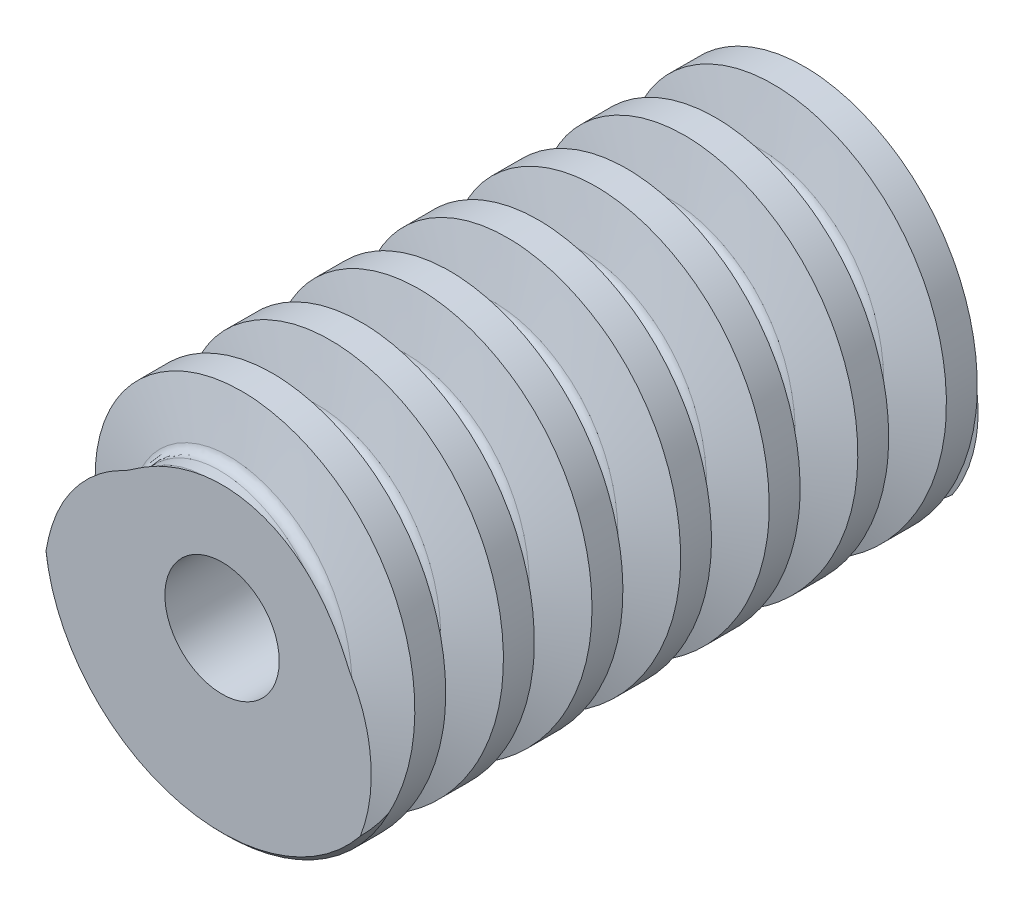
from build123d import *

# Parameters (mm, degrees)
TOOTH_CUT_SWEEP_RH_PD_1_1667IN_PITCH = 3.0988
SKETCH3_R                            = 2
CUT_EXTRUDE1_DEPTH                   = 24.383179999


with BuildPart() as part:
    # Worm-BaseSketch → 24.0 Diametral Pitch, Fine Pitch Involute 14.5 deg (revolve)
    with BuildSketch(Plane(origin=(0, 0, 0), x_dir=(0, 0, -1), z_dir=(1, 0, 0)), mode=Mode.PRIVATE) as f_24_0_diametral_pitch_fine_pitch_involut_sk:
        Polygon((-12.85875, 0), (8.73125, 0), (8.73125, 6.201833333), (8.583083333, 6.35), (-12.710583333, 6.35), (-12.85875, 6.201833333), align=None)
    revolve(f_24_0_diametral_pitch_fine_pitch_involut_sk.sketch.rotate(Axis((0, 0, 17.4625), (0, 0, -1)), 90), axis=Axis((0, 0, 17.4625), (0, 0, -1)))

    # Tooth-Cut-Sweep RH, PD: 1.1667in: arcs per turn and ends read off the stored shape
    # Tooth-Cut-Sweep RH, PD: 1.1667in: the profile of Tooth-Sketch screwed along a left-hand helix through 10 turns, 6 arcs to a turn; built about Z, then put on its axis
    tooth_cut_sweep_rh_pd_1_1667in_z = Axis((0, 0, 0), (0, 0, 1))
    tooth_cut_sweep_rh_pd_1_1667in_corners = [(6.985, 0, -0.177244567), (6.985, 0, -2.525307658), (4.605436511, 0, -1.907683218), (4.3434, 0, -1.568951566), (4.3434, 0, -1.133600659), (4.605436511, 0, -0.794869007)]
    with BuildLine(mode=Mode.PRIVATE) as tooth_cut_sweep_rh_pd_1_1667in_profile:
        Line(tooth_cut_sweep_rh_pd_1_1667in_corners[0], tooth_cut_sweep_rh_pd_1_1667in_corners[1])
        Line(tooth_cut_sweep_rh_pd_1_1667in_corners[1], tooth_cut_sweep_rh_pd_1_1667in_corners[2])
        Line(tooth_cut_sweep_rh_pd_1_1667in_corners[3], tooth_cut_sweep_rh_pd_1_1667in_corners[4])
        Line(tooth_cut_sweep_rh_pd_1_1667in_corners[5], tooth_cut_sweep_rh_pd_1_1667in_corners[0])
        ThreePointArc((4.605436511, 0, -1.907683218), (4.416555403, 0, -1.783079019), (4.3434, 0, -1.568951566))
        ThreePointArc((4.3434, 0, -1.133600659), (4.416555403, 0, -0.919473206), (4.605436511, 0, -0.794869007))
    tooth_cut_sweep_rh_pd_1_1667in_cap = Face(tooth_cut_sweep_rh_pd_1_1667in_profile.wire())
    tooth_cut_sweep_rh_pd_1_1667in_arcs = [((4.605436511, 0, -1.907683218), (4.3434, 0, -1.839670679), (4.3434, 0, -1.568951566), (1, 0.790958017560762, 1)), ((4.3434, 0, -1.133600659), (4.3434, 0, -0.862881546), (4.605436511, 0, -0.794869007), (1, 0.790958017560748, 1))]  # start, shoulder, end, weights
    tooth_cut_sweep_rh_pd_1_1667in_turn_angles = [0, -30, -60, -90, -120, -150, -180, -210, -240, -270, -300, -330, -360]
    tooth_cut_sweep_rh_pd_1_1667in_turn_weights = [1, 0.8660254037844387, 1, 0.8660254037844387, 1, 0.8660254037844387, 1, 0.8660254037844387, 1, 0.8660254037844387, 1, 0.8660254037844387, 1]
    tooth_cut_sweep_rh_pd_1_1667in_turn_rails = [Edge.make_bspline([Vector(p[0], p[1], 0).rotate(tooth_cut_sweep_rh_pd_1_1667in_z, tooth_cut_sweep_rh_pd_1_1667in_turn_angles[k]) / tooth_cut_sweep_rh_pd_1_1667in_turn_weights[k] + Vector(0, 0, p[2] + -TOOTH_CUT_SWEEP_RH_PD_1_1667IN_PITCH * tooth_cut_sweep_rh_pd_1_1667in_turn_angles[k] / 360) for k in range(13)], [0, 0, 0, 1, 1, 2, 2, 3, 3, 4, 4, 5, 5, 6, 6, 6], 2, tooth_cut_sweep_rh_pd_1_1667in_turn_weights) for p in tooth_cut_sweep_rh_pd_1_1667in_corners]
    tooth_cut_sweep_rh_pd_1_1667in_turn_sides = [*[Face.make_surface_from_curves(tooth_cut_sweep_rh_pd_1_1667in_turn_rails[p[0]], tooth_cut_sweep_rh_pd_1_1667in_turn_rails[p[1]]) for p in [(0, 1), (1, 2), (3, 4), (5, 0)]], *[Face.make_bezier_surface([[Vector(p[j][0], p[j][1], 0).rotate(tooth_cut_sweep_rh_pd_1_1667in_z, tooth_cut_sweep_rh_pd_1_1667in_turn_angles[2 * i + k]) / tooth_cut_sweep_rh_pd_1_1667in_turn_weights[2 * i + k] + Vector(0, 0, p[j][2] + -TOOTH_CUT_SWEEP_RH_PD_1_1667IN_PITCH * tooth_cut_sweep_rh_pd_1_1667in_turn_angles[2 * i + k] / 360) for k in range(3)] for j in range(3)], [[p[3][j] * tooth_cut_sweep_rh_pd_1_1667in_turn_weights[2 * i + k] for k in range(3)] for j in range(3)]) for p in tooth_cut_sweep_rh_pd_1_1667in_arcs for i in range(6)]]
    tooth_cut_sweep_rh_pd_1_1667in = Plane(origin=(0, 0, 15.24), x_dir=(1, 0, 0), z_dir=(0, 0, -1)) * Solid(Shell([*[p.moved(Location((0, 0, TOOTH_CUT_SWEEP_RH_PD_1_1667IN_PITCH * i))) for i in range(10) for p in tooth_cut_sweep_rh_pd_1_1667in_turn_sides], tooth_cut_sweep_rh_pd_1_1667in_cap, tooth_cut_sweep_rh_pd_1_1667in_cap.rotate(tooth_cut_sweep_rh_pd_1_1667in_z, -3600).moved(Location((0, 0, -TOOTH_CUT_SWEEP_RH_PD_1_1667IN_PITCH * -3600 / 360)))]))
    add(tooth_cut_sweep_rh_pd_1_1667in, mode=Mode.SUBTRACT)

    # Sketch3 → Cut-Extrude1 (cut, through all)
    with BuildSketch(Plane.XY.offset(12.85875)):
        Circle(SKETCH3_R)
    extrude(amount=-CUT_EXTRUDE1_DEPTH, mode=Mode.SUBTRACT)


solid = part.part
